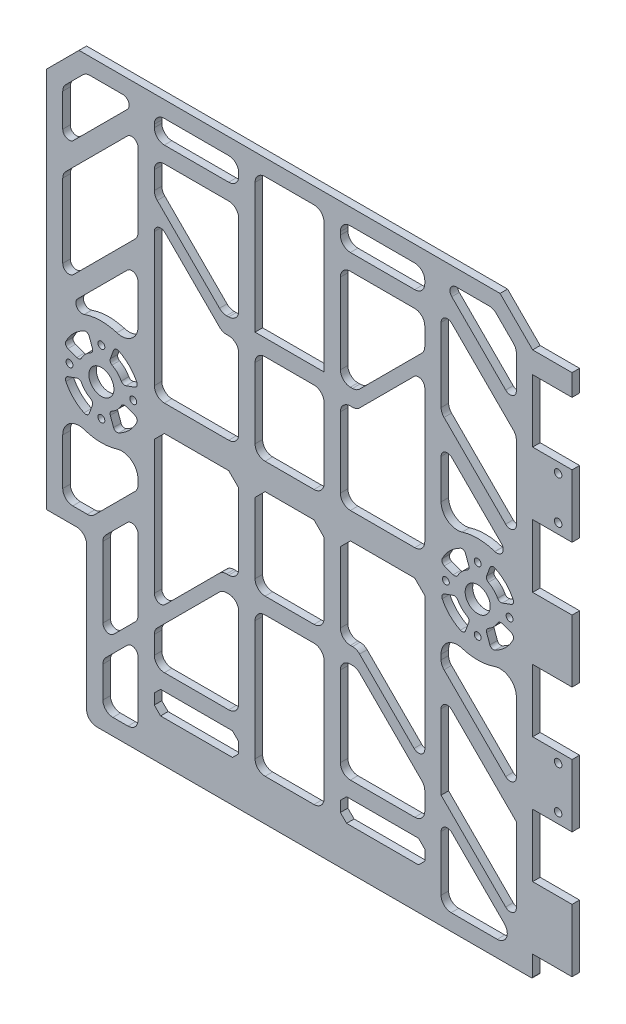
from build123d import *

# Parameters (mm, degrees)
ESBO_O1_W                = 387.6
ESBO_O1_H                = 480
RESSALTO_EXTRUS_O1_DEPTH = 6
CHANFRO1_SIZE            = 26
ESBO_O2_R                = 10
CORTE_EXTRUS_O1_DEPTH    = 617.984408231
ESBO_O3_R                = 2.75
CORTE_EXTRUS_O2_DEPTH    = 10
CORTE_EXTRUS_O3_DEPTH    = 617.984408231
FILETE1_R                = 3
ESBO_O11_W               = 32
ESBO_O11_H               = 150
CORTE_EXTRUS_O6_DEPTH    = 617.984408231
ESBO_O12_W               = 355.6
ESBO_O12_H               = 20
CORTE_EXTRUS_O7_DEPTH    = 617.984408231
FILETE2_R                = 8
CORTE_EXTRUS_O8_DEPTH    = 617.984408231
FILETE3_R                = 13
RESSALTO_EXTRUS_O2_DEPTH = 6
ESBO_O15_W               = 67.3
ESBO_O15_H               = 18.384776311
ESBO_O15_W_2             = 55
ESBO_O15_H_2             = 196.5
CORTE_EXTRUS_O9_DEPTH    = 617.984408231
ESBO_O16_W               = 55
ESBO_O16_H               = 13
RESSALTO_EXTRUS_O3_DEPTH = 6
FILETE4_R                = 8
FILETE5_R                = 8
FILETE6_R                = 5
FILETE7_R                = 1
RESSALTO_EXTRUS_O4_DEPTH = 6
ESBO_O18_W               = 55
ESBO_O18_H               = 13
RESSALTO_EXTRUS_O5_DEPTH = 6
CHANFRO2_SIZE            = 8
FILETE8_R                = 5
FILETE9_R                = 8
FILETE10_R               = 8
CHANFRO3_SIZE            = 5
ESBO_O19_W               = 6
ESBO_O19_H               = 50.039510427
ESBO_O19_H_2             = 50
ESBO_O19_H_3             = 49.729455934
ESBO_O19_H_4             = 17.097002058
RESSALTO_EXTRUS_O6_DEPTH = 31.4
ESBO_O21_R               = 3
CORTE_EXTRUS_O11_DEPTH   = 638.178938903


with BuildPart() as part:
    # Esboço1 → Ressalto-extrusão1 (new body)
    with BuildSketch(Plane.XY):
        with Locations((193.8, 240)):
            Rectangle(ESBO_O1_W, ESBO_O1_H)
    extrude(amount=RESSALTO_EXTRUS_O1_DEPTH)

    # Chanfro1
    chanfro1_edges = [part.edges().sort_by_distance(p)[0] for p in [
        (0, 480, 3),
        (387.6, 480, 3),
    ]]
    chamfer(chanfro1_edges, length=CHANFRO1_SIZE)

    # Esboço2 → Corte-extrusão1 (cut, through all)
    with BuildSketch(Plane.XY.offset(6)):
        with Locations((43.8, 260)):
            Circle(ESBO_O2_R)
        with Locations((343.8, 260)):
            Circle(ESBO_O2_R)
    extrude(amount=-CORTE_EXTRUS_O1_DEPTH, mode=Mode.SUBTRACT)

    # Esboço3 → Corte-extrusão2 (cut)
    with BuildSketch(Plane.XY.offset(6)):
        with Locations((43.8, 285.4)):
            Circle(ESBO_O3_R)
        with Locations((69.2, 260)):
            Circle(ESBO_O3_R)
        with Locations((43.8, 234.6)):
            Circle(ESBO_O3_R)
        with Locations((18.4, 260)):
            Circle(ESBO_O3_R)
        with Locations((343.8, 285.4)):
            Circle(ESBO_O3_R)
        with Locations((369.2, 260)):
            Circle(ESBO_O3_R)
        with Locations((343.8, 234.6)):
            Circle(ESBO_O3_R)
        with Locations((318.4, 260)):
            Circle(ESBO_O3_R)
    extrude(amount=-CORTE_EXTRUS_O2_DEPTH, mode=Mode.SUBTRACT)

    # Esboço5 → Corte-extrusão3 (cut, through all)
    with BuildSketch(Plane.XY.offset(6)):
        with BuildLine():
            Line((73.400317555, 270.773634515), (60.714467174, 266.15636258))
            ThreePointArc((60.714467174, 266.15636258), (56.527922061, 272.727922061), (49.95636258, 276.914467174))
            Line((49.95636258, 276.914467174), (54.573634515, 289.600317555))
            ThreePointArc((54.573634515, 289.600317555), (66.073863607, 282.273863607), (73.400317555, 270.773634515))
        make_face()
        with BuildLine():
            Line((14.199682445, 270.773634515), (26.885532826, 266.15636258))
            ThreePointArc((26.885532826, 266.15636258), (31.072077939, 272.727922061), (37.64363742, 276.914467174))
            Line((37.64363742, 276.914467174), (33.026365485, 289.600317555))
            ThreePointArc((33.026365485, 289.600317555), (21.526136393, 282.273863607), (14.199682445, 270.773634515))
        make_face()
        with BuildLine():
            Line((54.573634515, 230.399682445), (49.95636258, 243.085532826))
            ThreePointArc((49.95636258, 243.085532826), (56.527922061, 247.272077939), (60.714467174, 253.84363742))
            Line((60.714467174, 253.84363742), (73.400317555, 249.226365485))
            ThreePointArc((73.400317555, 249.226365485), (66.073863607, 237.726136393), (54.573634515, 230.399682445))
        make_face()
        with BuildLine():
            Line((14.199682445, 249.226365485), (26.885532826, 253.84363742))
            ThreePointArc((26.885532826, 253.84363742), (31.072077939, 247.272077939), (37.64363742, 243.085532826))
            Line((37.64363742, 243.085532826), (33.026365485, 230.399682445))
            ThreePointArc((33.026365485, 230.399682445), (21.526136393, 237.726136393), (14.199682445, 249.226365485))
        make_face()
        with BuildLine():
            Line((354.573634515, 230.399682445), (349.95636258, 243.085532826))
            ThreePointArc((349.95636258, 243.085532826), (356.527922061, 247.272077939), (360.714467174, 253.84363742))
            Line((360.714467174, 253.84363742), (373.400317555, 249.226365485))
            ThreePointArc((373.400317555, 249.226365485), (366.073863607, 237.726136393), (354.573634515, 230.399682445))
        make_face()
        with BuildLine():
            Line((314.199682445, 249.226365485), (326.885532826, 253.84363742))
            ThreePointArc((326.885532826, 253.84363742), (331.072077939, 247.272077939), (337.64363742, 243.085532826))
            Line((337.64363742, 243.085532826), (333.026365485, 230.399682445))
            ThreePointArc((333.026365485, 230.399682445), (321.526136393, 237.726136393), (314.199682445, 249.226365485))
        make_face()
        with BuildLine():
            Line((354.573634515, 289.600317555), (349.95636258, 276.914467174))
            ThreePointArc((349.95636258, 276.914467174), (356.527922061, 272.727922061), (360.714467174, 266.15636258))
            Line((360.714467174, 266.15636258), (373.400317555, 270.773634515))
            ThreePointArc((373.400317555, 270.773634515), (366.073863607, 282.273863607), (354.573634515, 289.600317555))
        make_face()
        with BuildLine():
            Line((333.026365485, 289.600317555), (337.64363742, 276.914467174))
            ThreePointArc((337.64363742, 276.914467174), (331.072077939, 272.727922061), (326.885532826, 266.15636258))
            Line((326.885532826, 266.15636258), (314.199682445, 270.773634515))
            ThreePointArc((314.199682445, 270.773634515), (321.526136393, 282.273863607), (333.026365485, 289.600317555))
        make_face()
    extrude(amount=-CORTE_EXTRUS_O3_DEPTH, mode=Mode.SUBTRACT)

    # Filete1
    filete1_edges = [part.edges().sort_by_distance(p)[0] for p in [
        (373.400317555, 249.226365485, 3),
        (354.573634515, 230.399682445, 3),
        (349.95636258, 243.085532826, 3),
        (360.714467174, 253.84363742, 3),
        (33.026365485, 230.399682445, 3),
        (14.199682445, 249.226365485, 3),
        (26.885532826, 253.84363742, 3),
        (37.64363742, 243.085532826, 3),
        (73.400317555, 249.226365485, 3),
        (54.573634515, 230.399682445, 3),
        (49.95636258, 243.085532826, 3),
        (60.714467174, 253.84363742, 3),
        (14.199682445, 270.773634515, 3),
        (33.026365485, 289.600317555, 3),
        (37.64363742, 276.914467174, 3),
        (26.885532826, 266.15636258, 3),
        (333.026365485, 230.399682445, 3),
        (314.199682445, 249.226365485, 3),
        (326.885532826, 253.84363742, 3),
        (337.64363742, 243.085532826, 3),
        (314.199682445, 270.773634515, 3),
        (333.026365485, 289.600317555, 3),
        (337.64363742, 276.914467174, 3),
        (326.885532826, 266.15636258, 3),
        (354.573634515, 289.600317555, 3),
        (373.400317555, 270.773634515, 3),
        (360.714467174, 266.15636258, 3),
        (349.95636258, 276.914467174, 3),
        (54.573634515, 289.600317555, 3),
        (73.400317555, 270.773634515, 3),
        (60.714467174, 266.15636258, 3),
        (49.95636258, 276.914467174, 3),
    ]]
    fillet(filete1_edges, radius=FILETE1_R)

    # Esboço11 → Corte-extrusão6 (cut, through all)
    with BuildSketch(Plane(origin=(0, 0, 0), x_dir=(-1, 0, 0), z_dir=(0, 0, -1))):
        with Locations((-16, 75)):
            Rectangle(ESBO_O11_W, ESBO_O11_H)
    extrude(amount=-CORTE_EXTRUS_O6_DEPTH, mode=Mode.SUBTRACT)

    # Esboço12 → Corte-extrusão7 (cut, through all)
    with BuildSketch(Plane(origin=(0, 0, 0), x_dir=(-1, 0, 0), z_dir=(0, 0, -1))):
        with Locations((-209.8, 10)):
            Rectangle(ESBO_O12_W, ESBO_O12_H)
    extrude(amount=-CORTE_EXTRUS_O7_DEPTH, mode=Mode.SUBTRACT)

    # Filete2
    filete2_edges = [part.edges().sort_by_distance(p)[0] for p in [
        (32, 150, 3),
        (32, 20, 3),
    ]]
    fillet(filete2_edges, radius=FILETE2_R)

    # Esboço13 → Corte-extrusão8 (cut, through all)
    with BuildSketch(Plane.XY.offset(6)):
        with BuildLine():
            Line((314.6, 33), (314.6, 229.811260377))
            ThreePointArc((314.6, 229.811260377), (344.943537147, 218.015570472), (374.6, 231.445490724))
            Line((374.6, 231.445490724), (374.6, 33))
            Line((374.6, 33), (314.6, 33))
        make_face()
        with BuildLine():
            Line((314.6, 467), (356.215223689, 467))
            Line((356.215223689, 467), (374.6, 448.615223689))
            Line((374.6, 448.615223689), (374.6, 288.554509276))
            ThreePointArc((374.6, 288.554509276), (344.943537147, 301.984429528), (314.6, 290.188739623))
            Line((314.6, 290.188739623), (314.6, 467))
        make_face()
        with BuildLine():
            Line((13, 231.445490724), (13, 163))
            Line((13, 163), (45, 163))
            Line((45, 163), (45, 33))
            Line((45, 33), (73, 33))
            Line((73, 33), (73, 229.811260377))
            ThreePointArc((73, 229.811260377), (42.656462853, 218.015570472), (13, 231.445490724))
        make_face()
        with BuildLine():
            Line((13, 448.615223689), (13, 288.554509276))
            ThreePointArc((13, 288.554509276), (42.656462853, 301.984429528), (73, 290.188739623))
            Line((73, 290.188739623), (73, 467))
            Line((73, 467), (31.384776311, 467))
            Line((31.384776311, 467), (13, 448.615223689))
        make_face()
    extrude(amount=-CORTE_EXTRUS_O8_DEPTH, mode=Mode.SUBTRACT)

    # Filete3
    filete3_edges = [part.edges().sort_by_distance(p)[0] for p in [
        (73, 290.188739623, 3),
        (13, 288.554509276, 3),
        (314.6, 229.811260377, 3),
        (374.6, 231.445490724, 3),
        (374.6, 288.554509276, 3),
        (314.6, 290.188739623, 3),
        (13, 231.445490724, 3),
        (73, 229.811260377, 3),
    ]]
    fillet(filete3_edges, radius=FILETE3_R)

    # Esboço14 → Ressalto-extrusão2 (add, through all)
    with BuildSketch(Plane.XY.offset(6)):
        Polygon((73, 467), (13, 407), (13, 388.615223689), (73, 448.615223689), align=None)
        with BuildLine():
            Line((13, 314.40891612), (73, 374.40891612))
            Line((73, 374.40891612), (73, 356.02413981))
            Line((73, 356.02413981), (18.44005772, 301.46419753))
            ThreePointArc((18.44005772, 301.46419753), (13.822029982, 307.138916971), (13, 314.40891612))
        make_face()
        Polygon((314.6, 467), (374.6, 407), (374.6, 388.615223689), (314.6, 448.615223689), align=None)
        with BuildLine():
            ThreePointArc((374.6, 314.40891612), (373.777970018, 307.138916971), (369.15994228, 301.46419753))
            Line((369.15994228, 301.46419753), (314.6, 356.02413981))
            Line((314.6, 356.02413981), (314.6, 374.40891612))
            Line((314.6, 374.40891612), (374.6, 314.40891612))
        make_face()
    extrude(amount=-RESSALTO_EXTRUS_O2_DEPTH)

    # Esboço15 → Corte-extrusão9 (cut, through all)
    with BuildSketch(Plane.XY.offset(6)):
        Polygon((86, 435.615223689), (86, 409.915223689), (140.3, 355.615223689), (153.3, 355.615223689), (153.3, 435.615223689), align=None)
        Polygon((86, 396.915223689), (140.3, 342.615223689), (153.3, 342.615223689), (153.3, 270.5), (86, 270.5), align=None)
        with Locations((119.65, 457.807611845)):
            Rectangle(ESBO_O15_W, ESBO_O15_H)
        with Locations((193.8, 368.75)):
            Rectangle(ESBO_O15_W_2, ESBO_O15_H_2)
        with Locations((267.95, 457.807611845)):
            Rectangle(ESBO_O15_W, ESBO_O15_H)
        Polygon((301.6, 270.5), (301.6, 396.915223689), (247.3, 342.615223689), (234.3, 342.615223689), (234.3, 270.5), align=None)
        Polygon((234.3, 435.615223689), (301.6, 435.615223689), (301.6, 409.915223689), (247.3, 355.615223689), (234.3, 355.615223689), align=None)
        Polygon((301.6, 84.384776311), (301.6, 110.084776311), (247.3, 164.384776311), (234.3, 164.384776311), (234.3, 84.384776311), align=None)
        Polygon((301.6, 123.084776311), (247.3, 177.384776311), (234.3, 177.384776311), (234.3, 249.5), (301.6, 249.5), align=None)
        with Locations((267.95, 62.192388156)):
            Rectangle(ESBO_O15_W, ESBO_O15_H)
        with Locations((193.8, 151.25)):
            Rectangle(ESBO_O15_W_2, ESBO_O15_H_2)
        with Locations((119.65, 62.192388156)):
            Rectangle(ESBO_O15_W, ESBO_O15_H)
        Polygon((86, 249.5), (86, 123.084776311), (140.3, 177.384776311), (153.3, 177.384776311), (153.3, 249.5), align=None)
        Polygon((153.3, 84.384776311), (86, 84.384776311), (86, 110.084776311), (140.3, 164.384776311), (153.3, 164.384776311), align=None)
    extrude(amount=-CORTE_EXTRUS_O9_DEPTH, mode=Mode.SUBTRACT)

    # Esboço16 → Ressalto-extrusão3 (add, through all)
    with BuildSketch(Plane.XY.offset(6)):
        with Locations((193.8, 349.115223689)):
            Rectangle(ESBO_O16_W, ESBO_O16_H)
    extrude(amount=-RESSALTO_EXTRUS_O3_DEPTH)

    # Filete4
    filete4_edges = [part.edges().sort_by_distance(p)[0] for p in [
        (13, 448.615223689, 3),
        (31.384776311, 467, 3),
        (356.215223689, 467, 3),
        (374.6, 448.615223689, 3),
        (13, 388.615223689, 3),
        (73, 374.40891612, 3),
        (374.6, 388.615223689, 3),
        (314.6, 374.40891612, 3),
        (301.6, 270.5, 3),
        (234.3, 270.5, 3),
        (234.3, 342.615223689, 3),
        (234.3, 355.615223689, 3),
        (234.3, 435.615223689, 3),
        (301.6, 435.615223689, 3),
        (301.6, 409.915223689, 3),
        (247.3, 355.615223689, 3),
        (234.3, 448.615223689, 3),
        (234.3, 467, 3),
        (301.6, 467, 3),
        (301.6, 448.615223689, 3),
        (166.3, 270.5, 3),
        (166.3, 467, 3),
        (221.3, 467, 3),
        (221.3, 270.5, 3),
        (153.3, 448.615223689, 3),
        (86, 448.615223689, 3),
        (86, 467, 3),
        (153.3, 467, 3),
        (86, 270.5, 3),
        (153.3, 342.615223689, 3),
        (153.3, 270.5, 3),
        (86, 435.615223689, 3),
        (153.3, 435.615223689, 3),
        (153.3, 355.615223689, 3),
        (140.3, 355.615223689, 3),
        (86, 409.915223689, 3),
        (166.3, 342.615223689, 3),
        (221.3, 342.615223689, 3),
    ]]
    fillet(filete4_edges, radius=FILETE4_R)

    # Filete5
    filete5_edges = [part.edges().sort_by_distance(p)[0] for p in [
        (247.3, 342.615223689, 3),
        (140.3, 342.615223689, 3),
    ]]
    fillet(filete5_edges, radius=FILETE5_R)

    # Filete6
    filete6_edges = [part.edges().sort_by_distance(p)[0] for p in [
        (73, 467, 3),
        (314.6, 467, 3),
        (73, 448.615223689, 3),
        (13, 407, 3),
        (13, 314.40891612, 3),
        (73, 356.02413981, 3),
        (18.44005772, 301.46419753, 3),
        (374.6, 407, 3),
        (314.6, 448.615223689, 3),
        (374.6, 314.40891612, 3),
        (369.15994228, 301.46419753, 3),
        (314.6, 356.02413981, 3),
        (301.6, 396.915223689, 3),
        (86, 396.915223689, 3),
    ]]
    fillet(filete6_edges, radius=FILETE6_R)

    # Filete7
    filete7_edges = [part.edges().sort_by_distance(p)[0] for p in [
        (387.6, 20, 3),
    ]]
    fillet(filete7_edges, radius=FILETE7_R)

    # Esboço17 → Ressalto-extrusão4 (add, through all)
    with BuildSketch(Plane.XY.offset(6)):
        Polygon((35.807611845, 163), (73, 200.192388155), (73, 181.807611845), (45, 153.807611845), (45, 163), align=None)
        Polygon((73, 110.084776311), (45, 82.084776311), (45, 69.084776311), (73, 97.084776311), align=None)
        Polygon((314.6, 97.084776311), (314.6, 110.084776311), (342.6, 82.084776311), (374.6, 50.084776311), (374.6, 37.084776311), (342.6, 69.084776311), align=None)
        Polygon((314.6, 181.807611845), (314.6, 200.192388155), (351.792388155, 163), (374.6, 140.192388155), (374.6, 121.807611845), (342.6, 153.807611845), align=None)
    extrude(amount=-RESSALTO_EXTRUS_O4_DEPTH)

    # Esboço18 → Ressalto-extrusão5 (add, through all)
    with BuildSketch(Plane.XY.offset(6)):
        with Locations((193.8, 170.884776311)):
            Rectangle(ESBO_O18_W, ESBO_O18_H)
    extrude(amount=-RESSALTO_EXTRUS_O5_DEPTH)

    # Chanfro2
    chanfro2_edges = [part.edges().sort_by_distance(p)[0] for p in [
        (301.6, 249.5, 3),
        (234.3, 249.5, 3),
        (86, 249.5, 3),
        (153.3, 249.5, 3),
        (166.3, 249.5, 3),
        (221.3, 249.5, 3),
    ]]
    chamfer(chanfro2_edges, length=CHANFRO2_SIZE)

    # Filete8
    filete8_edges = [part.edges().sort_by_distance(p)[0] for p in [
        (73, 181.807611845, 3),
        (45, 82.084776311, 3),
        (73, 97.084776311, 3),
        (314.6, 97.084776311, 3),
        (374.6, 50.084776311, 3),
        (374.6, 140.192388155, 3),
        (314.6, 181.807611845, 3),
        (301.6, 123.084776311, 3),
        (86, 123.084776311, 3),
    ]]
    fillet(filete8_edges, radius=FILETE8_R)

    # Filete9
    filete9_edges = [part.edges().sort_by_distance(p)[0] for p in [
        (35.807611845, 163, 3),
        (73, 200.192388155, 3),
        (45, 153.807611845, 3),
        (45, 69.084776311, 3),
        (73, 110.084776311, 3),
        (314.6, 200.192388155, 3),
        (166.3, 164.384776311, 3),
        (166.3, 177.384776311, 3),
        (221.3, 177.384776311, 3),
        (221.3, 164.384776311, 3),
        (314.6, 33, 3),
        (73, 33, 3),
        (45, 33, 3),
        (13, 163, 3),
        (301.6, 84.384776311, 3),
        (234.3, 84.384776311, 3),
        (234.3, 164.384776311, 3),
        (247.3, 164.384776311, 3),
        (301.6, 110.084776311, 3),
        (247.3, 177.384776311, 3),
        (234.3, 177.384776311, 3),
        (153.3, 164.384776311, 3),
        (153.3, 84.384776311, 3),
        (86, 84.384776311, 3),
        (86, 110.084776311, 3),
        (140.3, 164.384776311, 3),
        (153.3, 177.384776311, 3),
        (140.3, 177.384776311, 3),
        (221.3, 53, 3),
        (166.3, 53, 3),
    ]]
    fillet(filete9_edges, radius=FILETE9_R)

    # Filete10
    filete10_edges = [part.edges().sort_by_distance(p)[0] for p in [
        (374.6, 37.084776311, 3),
    ]]
    fillet(filete10_edges, radius=FILETE10_R)
    filete10_2_edges = [part.edges().sort_by_distance(p)[0] for p in [
        (374.6, 33, 3),
    ]]
    fillet(filete10_2_edges, radius=FILETE10_R - 0.0001)  # a hair under: the kernel refuses the full size

    # Chanfro3
    chanfro3_edges = [part.edges().sort_by_distance(p)[0] for p in [
        (153.3, 71.384776311, 3),
        (153.3, 53, 3),
        (86, 53, 3),
        (86, 71.384776311, 3),
        (234.3, 71.384776311, 3),
        (301.6, 71.384776311, 3),
        (301.6, 53, 3),
        (234.3, 53, 3),
    ]]
    chamfer(chanfro3_edges, length=CHANFRO3_SIZE)

    # Esboço19 → Ressalto-extrusão6 (add)
    with BuildSketch(Plane(origin=(387.6, 0, 0), x_dir=(0, 0, -1), z_dir=(1, 0, 0))):
        with Locations((-3, 361.883242729)):
            Rectangle(ESBO_O19_W, ESBO_O19_H)
        with Locations((-3, 161.902997942)):
            Rectangle(ESBO_O19_W, ESBO_O19_H_2)
        with Locations((-3, 261.767725909)):
            Rectangle(ESBO_O19_W, ESBO_O19_H_3)
        with Locations((-3, 445.451498971)):
            Rectangle(ESBO_O19_W, ESBO_O19_H_4)
        with Locations((-3, 61.902997942)):
            Rectangle(ESBO_O19_W, ESBO_O19_H_2)
    extrude(amount=RESSALTO_EXTRUS_O6_DEPTH)

    # Esboço21 → Corte-extrusão11 (cut, through all)
    with BuildSketch(Plane(origin=(0, 0, 0), x_dir=(-1, 0, 0), z_dir=(0, 0, -1))):
        with Locations((-407.9, 378.902997942)):
            Circle(ESBO_O21_R)
        with Locations((-407.9, 344.902997942)):
            Circle(ESBO_O21_R)
        with Locations((20.3, 378.902997942)):
            Circle(ESBO_O21_R)
        with Locations((20.3, 344.902997942)):
            Circle(ESBO_O21_R)
        with Locations((20.3, 168.452997942)):
            Circle(ESBO_O21_R)
        with Locations((-407.9, 178.902997942)):
            Circle(ESBO_O21_R)
        with Locations((-407.9, 144.902997942)):
            Circle(ESBO_O21_R)
    extrude(amount=-CORTE_EXTRUS_O11_DEPTH, mode=Mode.SUBTRACT)


solid = part.part
